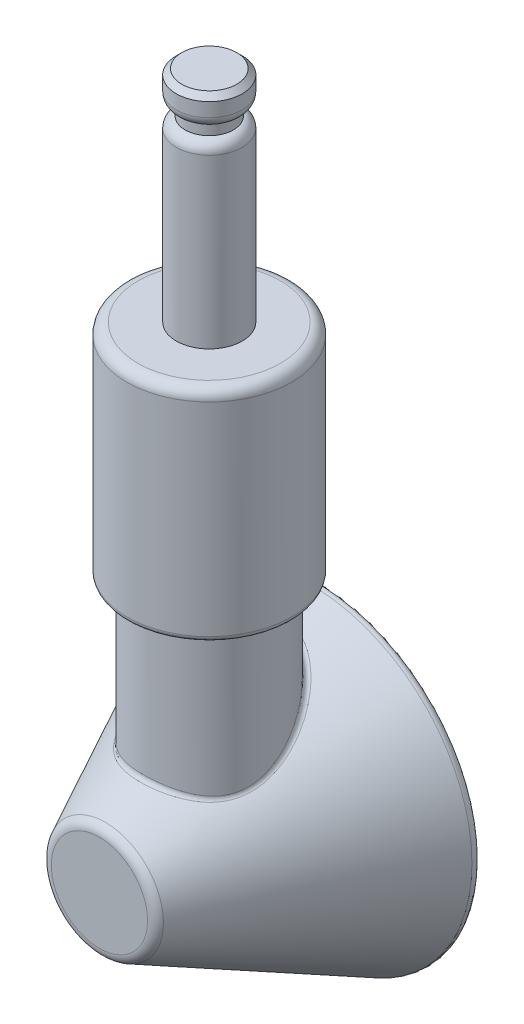
from build123d import *

# Parameters (mm, degrees)
SKETCH1_W          = 20
SKETCH1_H          = 6
SKETCH1_W_2        = 2.75
SKETCH1_H_2        = 3
CHAMFER1_SIZE      = 0.5
SKETCH4_R          = 3
CUT_EXTRUDE1_DEPTH = 10
FILLET2_R          = 0.5
FILLET1_R          = 1


# Read off the part's stored shape, not the designer's step: Boundary1
with BuildPart() as part:
    # Sketch1 → Revolve1 (revolve)
    with BuildSketch(Plane.YZ, mode=Mode.PRIVATE) as revolve1_sk:
        with Locations((-30, 3)):
            Rectangle(SKETCH1_W, SKETCH1_H)
        Polygon((-20, 0), (0, 0), (0, 3), (0, 7.5), (-20, 7.5), (-20, 6), align=None)
        Polygon((0, 0), (17.25, 0), (17.25, 2.2), (16.25, 2.2), (16.25, 3), (0, 3), align=None)
        with Locations((18.625, 1.5)):
            Rectangle(SKETCH1_W_2, SKETCH1_H_2)
    revolve(revolve1_sk.sketch.rotate(Axis((0, -56.987637363, 0), (0, 1, 0)), 180), axis=Axis((0, -56.987637363, 0), (0, 1, 0)))

    # Chamfer1
    chamfer1_edges = [part.edges().sort_by_distance(p)[0] for p in [
        (0, 20, 3),
    ]]
    chamfer(chamfer1_edges, length=CHAMFER1_SIZE)

    # Boundary1 outline → Boundary1 (revolve)
    with BuildSketch(Plane.XZ.offset(40)):
        Polygon((15, -10), (5, 10), (0, 10), (0, -10), align=None)
    revolve(axis=Axis((0, -40, 0), (0, 0, 1)))

    # Sketch4 → Cut-Extrude1 (cut)
    with BuildSketch(Plane(origin=(0, 0, -10), x_dir=(1, 0, 0), z_dir=(0, 0, -1))):
        with Locations(Location((0, 40, 0), (0, 0, 180))):
            Circle(SKETCH4_R)
    extrude(amount=-CUT_EXTRUDE1_DEPTH, mode=Mode.SUBTRACT)

    # Fillet2
    fillet2_edges = [part.edges().sort_by_distance(p)[0] for p in [
        (0, -20, 6),
        (0, -20, 7.5),
        (0, -33, 6),
        (-15, -40, -10),
        (3, -40, -10),
    ]]
    fillet(fillet2_edges, radius=FILLET2_R)

    # Fillet1
    # the kernel refuses this fillet: 1 mm, written as the material it takes off along each edge
    with BuildSketch(Plane(origin=(0, 0, 0), x_dir=(0, 0, -1), z_dir=(1, 0, 0))) as fillet1_piece_1:
        with BuildLine():
            CenterArc((7.5 - FILLET1_R, -FILLET1_R), FILLET1_R, 0, 90)
            Line((7.5 - FILLET1_R, 0), (7.5 - FILLET1_R, FILLET1_R * 0.02))
            Line((7.5 - FILLET1_R, FILLET1_R * 0.02), (7.5 + FILLET1_R * 0.02, FILLET1_R * 0.02))
            Line((7.5 + FILLET1_R * 0.02, FILLET1_R * 0.02), (7.5 + FILLET1_R * 0.02, -FILLET1_R))
            Line((7.5 + FILLET1_R * 0.02, -FILLET1_R), (7.5, -FILLET1_R))
        make_face()
    revolve(axis=Axis((0, 0, 0), (0, 1, 0)), mode=Mode.SUBTRACT)
    with BuildSketch(Plane(origin=(0, 16.25, 0), x_dir=(0, 0, -1), z_dir=(1, 0, 0))) as fillet1_piece_2:
        with BuildLine():
            CenterArc((2, -0.979795897), FILLET1_R, 0, 78.463040967)
            Line((2.2, 0), (2.204, 0.019595918))
            ThreePointArc((2.204, 0.019595918), (2.6, 0.02), (3, 0.02))
            Line((3, 0.02), (3.02, 0))
            Line((3.02, 0), (3.02, -0.979795897))
            Line((3.02, -0.979795897), (3, -0.979795897))
        make_face()
    revolve(axis=Axis((0, 16.25, 0), (0, 1, 0)), mode=Mode.SUBTRACT)
    with BuildSketch(Plane(origin=(0, 17.25, 0), x_dir=(0, 0, -1), z_dir=(1, 0, 0))) as fillet1_piece_3:
        with BuildLine():
            CenterArc((2, 0.979795897), FILLET1_R, 281.536959033, 78.463040967)
            Line((3, 0.979795897), (3.02, 0.979795897))
            Line((3.02, 0.979795897), (3.02, 0))
            Line((3.02, 0), (3, -0.02))
            ThreePointArc((3, -0.02), (2.6, -0.02), (2.204, -0.019595918))
            Line((2.204, -0.019595918), (2.2, 0))
        make_face()
    revolve(axis=Axis((0, 17.25, 0), (0, 1, 0)), mode=Mode.SUBTRACT)
    with BuildSketch(Plane(origin=(0, -40, 10), x_dir=(1, 0, 0), z_dir=(0, -1, 0))) as fillet1_piece_4:
        with BuildLine():
            CenterArc((5 - FILLET1_R * 0.61803398875, -FILLET1_R), FILLET1_R, 26.565051177, 63.434948823)
            Line((5 - FILLET1_R * 0.61803398875, 0), (5 - FILLET1_R * 0.61803398875, FILLET1_R * 0.02))
            Line((5 - FILLET1_R * 0.61803398875, FILLET1_R * 0.02), (5 + FILLET1_R * 0.012360679775, FILLET1_R * 0.02))
            Line((5 + FILLET1_R * 0.012360679775, FILLET1_R * 0.02), (5 + FILLET1_R * 0.29428174607, -FILLET1_R * 0.54384213259))
            Line((5 + FILLET1_R * 0.29428174607, -FILLET1_R * 0.54384213259), (5 + FILLET1_R * 0.27639320225, -FILLET1_R * 0.5527864045))
        make_face()
    revolve(axis=Axis((0, -40, 10), (0, 0, 1)), mode=Mode.SUBTRACT)


solid = part.part
